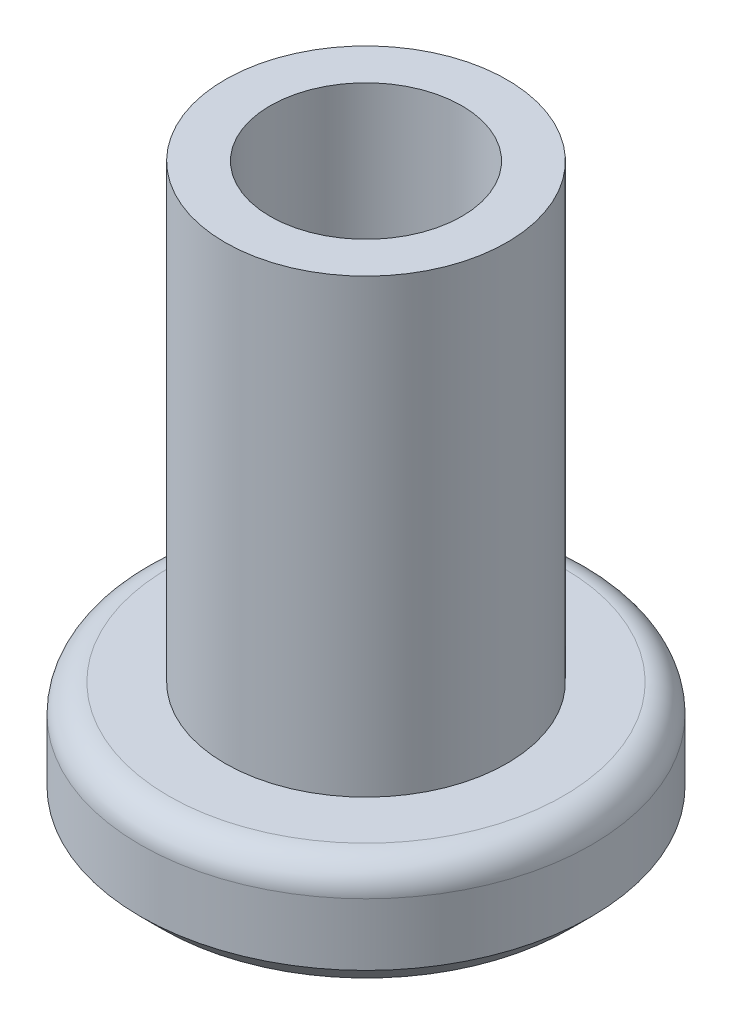
from build123d import *

# Parameters (mm, degrees)
SKETCH1_R           = 2.5
SKETCH1_R_2         = 1.7
BOSS_EXTRUDE1_DEPTH = 8
BOSS_EXTRUDE2_START = -2
SKETCH1_3_R         = 4
SKETCH1_3_R_2       = 1.7
BOSS_EXTRUDE2_DEPTH = 2
FILLET1_R           = 0.5
CHAMFER1_SIZE       = 0.4


with BuildPart() as part:
    # Sketch1 → Boss-Extrude1 (new body)
    with BuildSketch(Plane(origin=(0, 0, 0), x_dir=(1, 0, 0), z_dir=(0, 1, 0))):
        Circle(SKETCH1_R)
        Circle(SKETCH1_R_2, mode=Mode.SUBTRACT)
    extrude(amount=BOSS_EXTRUDE1_DEPTH)

    # Sketch1<3> → Boss-Extrude2 (add)
    with BuildSketch(Plane(origin=(0, 0, 0), x_dir=(1, 0, 0), z_dir=(0, 1, 0)).offset(BOSS_EXTRUDE2_START)):
        Circle(SKETCH1_3_R)
        Circle(SKETCH1_3_R_2, mode=Mode.SUBTRACT)
    extrude(amount=BOSS_EXTRUDE2_DEPTH)

    # Fillet1
    fillet1_edges = [part.edges().sort_by_distance(p)[0] for p in [
        (-4, 0, 0),
    ]]
    fillet(fillet1_edges, radius=FILLET1_R)

    # Chamfer1
    chamfer1_edges = [part.edges().sort_by_distance(p)[0] for p in [
        (-4, -2, 0),
        (-1.7, -2, 0),
    ]]
    chamfer(chamfer1_edges, length=CHAMFER1_SIZE)


solid = part.part
